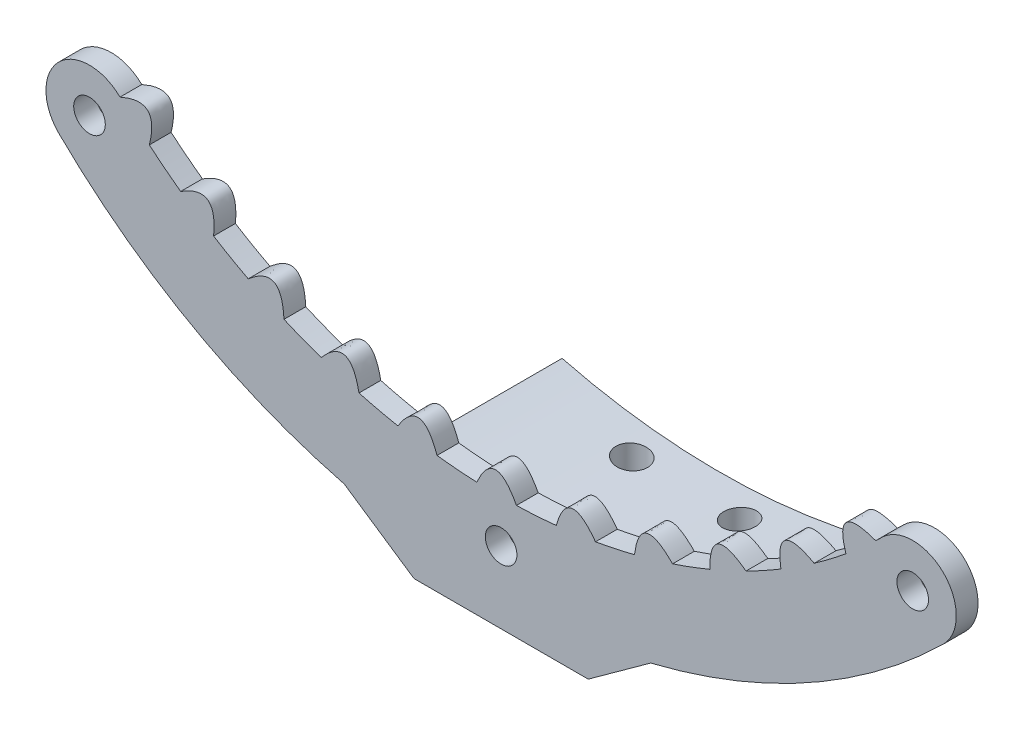
from build123d import *

# Parameters (mm, degrees)
EXTRUDE_1_DEPTH     = 2
EXTRUDE_START       = -2
EXTRUDE_6_DEPTH     = 2
SKETCH_3_R          = 1.45
CUT_EXTRUDE_1_DEPTH = 2
EXTRUDE_START_2     = -20
EXTRUDE_7_DEPTH     = 20
SKETCH_6_R          = 1.45
CUT_EXTRUDE_2_DEPTH = 20


with BuildPart() as part:
    # 草图1 → 凸台-拉伸1 (new body)
    with BuildSketch(Plane.XY):
        with BuildLine():
            ThreePointArc((34.999399669, -35.707730574), (0, -50), (-34.999399669, -35.707730574))
            ThreePointArc((-34.999399669, -35.707730574), (-40.655970089, -35.764397047), (-40.599303617, -41.420967466))
            ThreePointArc((-40.599303617, -41.420967466), (0, -58), (40.599303617, -41.420967466))
            ThreePointArc((40.599303617, -41.420967466), (40.655970089, -35.764397047), (34.999399669, -35.707730574))
        make_face()
    extrude(amount=EXTRUDE_1_DEPTH)

    # 草图2 → 凸台-拉伸6 (add)
    with BuildSketch(Plane.XY.offset(2).offset(EXTRUDE_START)):
        with BuildLine():
            add(Edge.make_bspline(
                [(-34.999399669, -35.707730574), (-31.293036679, -34.051470167), (-32.304776642, -38.162827543)],
                knots=[0, 0, 0, 1, 1, 1], degree=2))
            ThreePointArc((-34.999399669, -35.707730574), (-33.674469744, -36.959844257), (-32.304776642, -38.162827543))
        make_face()
        with BuildLine():
            add(Edge.make_bspline(
                [(31.66559238, -38.694835046), (30.424637319, -34.829559417), (34.400675338, -36.284894051)],
                knots=[0, 0, 0, 1, 1, 1], degree=2))
            ThreePointArc((31.66559238, -38.694835046), (33.055103788, -37.514798594), (34.400675338, -36.284894051))
        make_face()
        with BuildLine():
            add(Edge.make_bspline(
                [(25.69413065, -42.893025659), (25.029188635, -38.888256343), (28.750957058, -40.906997791)],
                knots=[0, 0, 0, 1, 1, 1], degree=2))
            ThreePointArc((25.69413065, -42.893025659), (27.240649231, -41.927878905), (28.750957058, -40.906997791))
        make_face()
        with BuildLine():
            add(Edge.make_bspline(
                [(19.175043133, -46.177025899), (19.100286249, -42.118117602), (22.488462044, -44.657239893)],
                knots=[0, 0, 0, 1, 1, 1], degree=2))
            ThreePointArc((19.175043133, -46.177025899), (20.84560753, -45.44733927), (22.488462044, -44.657239893))
        make_face()
        with BuildLine():
            add(Edge.make_bspline(
                [(12.247272863, -48.476843002), (12.764294423, -44.450304307), (15.746664505, -47.455690459)],
                knots=[0, 0, 0, 1, 1, 1], degree=2))
            ThreePointArc((12.247272863, -48.476843002), (14.006277895, -47.998168502), (15.746664505, -47.455690459))
        make_face()
        with BuildLine():
            add(Edge.make_bspline(
                [(5.058473235, -49.743460359), (6.156253823, -45.835109949), (8.669254151, -49.242705373)],
                knots=[0, 0, 0, 1, 1, 1], degree=2))
            ThreePointArc((5.058473235, -49.743460359), (6.868428764, -49.526000104), (8.669254151, -49.242705373))
        make_face()
        with BuildLine():
            add(Edge.make_bspline(
                [(-2.238138968, -49.949882222), (-0.58299664, -46.243019798), (1.407073696, -49.980197515)],
                knots=[0, 0, 0, 1, 1, 1], degree=2))
            ThreePointArc((-2.238138968, -49.949882222), (-0.415809002, -49.998270999), (1.407073696, -49.980197515))
        make_face()
        with BuildLine():
            add(Edge.make_bspline(
                [(-9.487049125, -49.091709065), (-7.309821542, -45.665339966), (-5.885096092, -49.65244852)],
                knots=[0, 0, 0, 1, 1, 1], degree=2))
            ThreePointArc((-9.487049125, -49.091709065), (-7.69118452, -49.404915552), (-5.885096092, -49.65244852))
        make_face()
        with BuildLine():
            add(Edge.make_bspline(
                [(-16.5337593, -47.18723136), (-13.880850288, -44.114382693), (-13.051835275, -48.266443788)],
                knots=[0, 0, 0, 1, 1, 1], degree=2))
            ThreePointArc((-16.5337593, -47.18723136), (-14.802635794, -47.758580104), (-13.051835275, -48.266443788))
        make_face()
        with BuildLine():
            add(Edge.make_bspline(
                [(-23.228081101, -44.277039743), (-20.15603281, -41.623203943), (-19.940397248, -45.851723605)],
                knots=[0, 0, 0, 1, 1, 1], degree=2))
            ThreePointArc((-23.228081101, -44.277039743), (-21.598594585, -45.094353437), (-19.940397248, -45.851723605))
        make_face()
        with BuildLine():
            add(Edge.make_bspline(
                [(-29.427336681, -40.423159895), (-26.001624486, -38.244898865), (-26.403964274, -42.459753539)],
                knots=[0, 0, 0, 1, 1, 1], degree=2))
            ThreePointArc((-29.427336681, -40.423159895), (-27.934216832, -41.469018918), (-26.403964274, -42.459753539))
        make_face()
    extrude(amount=EXTRUDE_6_DEPTH)

    # 草图3 → 切除-拉伸1 (cut)
    with BuildSketch(Plane.XY.offset(2)):
        with Locations((-37.799351643, -38.56434902)):
            Circle(SKETCH_3_R)
        with Locations((37.799351643, -38.56434902)):
            Circle(SKETCH_3_R)
        with Locations((0, -53.900429622)):
            Circle(SKETCH_3_R)
    extrude(amount=-CUT_EXTRUDE_1_DEPTH, mode=Mode.SUBTRACT)

    # 草图5 → 凸台-拉伸7 (add)
    with BuildSketch(Plane.XY.offset(2).offset(EXTRUDE_START_2)):
        with BuildLine():
            Line((-14.400360847, -56.183890996), (-8, -60.499906827))
            Line((-8, -60.499906827), (8, -60.499906827))
            Line((8, -60.499906827), (13.738692935, -56.349341757))
            ThreePointArc((13.738692935, -56.349341757), (-0.341019933, -57.998997452), (-14.400360847, -56.183890996))
        make_face()
    extrude(amount=EXTRUDE_7_DEPTH)

    # 草图6 → 切除-拉伸2 (cut)
    with BuildSketch(Plane.XZ.offset(60.499906827)):
        with Locations((-4.94974747, -5.05)):
            Circle(SKETCH_6_R)
        with Locations((-4.94974747, -14.94949494)):
            Circle(SKETCH_6_R)
        with Locations((4.94974747, -14.94949494)):
            Circle(SKETCH_6_R)
        with Locations((4.94974747, -5.05)):
            Circle(SKETCH_6_R)
    extrude(amount=-CUT_EXTRUDE_2_DEPTH, mode=Mode.SUBTRACT)


solid = part.part
